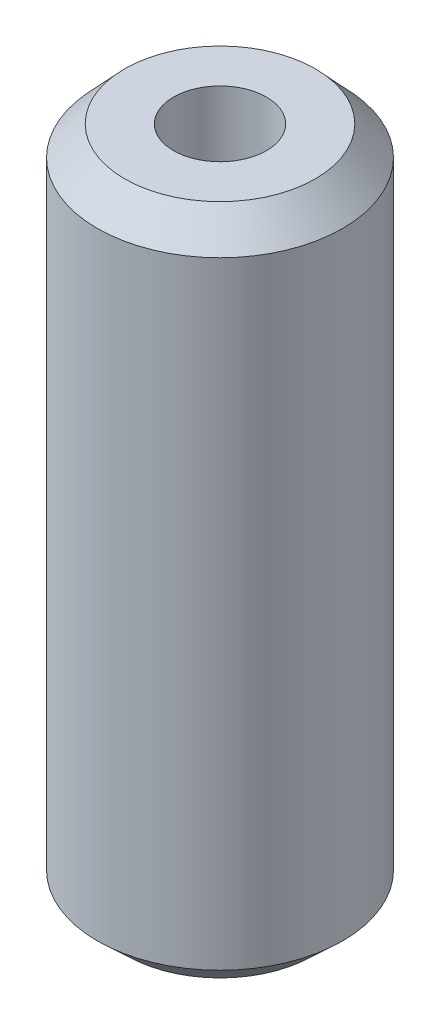
from build123d import *
from OCP.BRepFilletAPI import BRepFilletAPI_MakeChamfer

# Parameters (mm, degrees)
SKETCH1_R           = 5
BOSS_EXTRUDE1_DEPTH = 27.456736103
SKETCH2_R           = 1.894052536
CUT_EXTRUDE1_DEPTH  = 29.352642865
CHAMFER1_SIZE       = 1.192257139
CHAMFER1_SIZE2      = 1.114617524


with BuildPart() as part:
    # Sketch1 → Boss-Extrude1 (new body)
    with BuildSketch(Plane(origin=(0, 0, 0), x_dir=(1, 0, 0), z_dir=(0, 1, 0))):
        Circle(SKETCH1_R)
    extrude(amount=BOSS_EXTRUDE1_DEPTH)

    # Sketch2 → Cut-Extrude1 (cut, through all)
    with BuildSketch(Plane(origin=(0, 0, 0), x_dir=(1, 0, 0), z_dir=(0, 1, 0))):
        Circle(SKETCH2_R)
    extrude(amount=CUT_EXTRUDE1_DEPTH, mode=Mode.SUBTRACT)

    # Chamfer1: one chamfer whose edges measure the first distance from different faces: ONE call of the kernel's chamfer builder (chamfer() names one face for all edges)
    chamfer1_edges_1 = [part.edges().sort_by_distance(p)[0] for p in [
        (-5, 27.456736103, 0),
    ]]
    chamfer1_side_1 = [part.faces().sort_by_distance(p)[0] for p in [
        (-5, 13.728368051, 0),
    ]]
    chamfer1_edges_2 = [part.edges().sort_by_distance(p)[0] for p in [
        (-5, 0, 0),
    ]]
    chamfer1_side_2 = [part.faces().sort_by_distance(p)[0] for p in [
        (-4.858578644, 0, 0),
    ]]
    chamfer1 = BRepFilletAPI_MakeChamfer(part.part.solid().wrapped)
    for e in chamfer1_edges_1:
        chamfer1.Add(CHAMFER1_SIZE, CHAMFER1_SIZE2, e.wrapped, chamfer1_side_1[0].wrapped)  # the first distance lies on this face
    for e in chamfer1_edges_2:
        chamfer1.Add(CHAMFER1_SIZE, CHAMFER1_SIZE2, e.wrapped, chamfer1_side_2[0].wrapped)  # the first distance lies on this face
    add(Compound.cast(chamfer1.Shape()), mode=Mode.REPLACE)


solid = part.part
